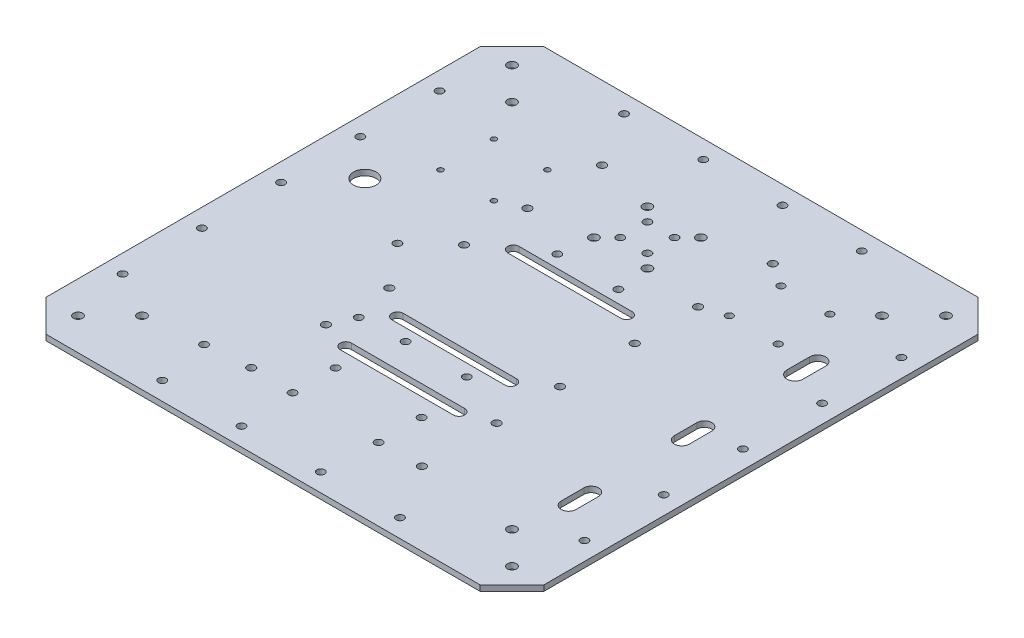
from build123d import *

# Parameters (mm, degrees)
BOSS_EXTRUDE1_DEPTH = 3.175
SKETCH2_R           = 2.159
CUT_EXTRUDE1_DEPTH  = 257.37661277
CUT_EXTRUDE2_DEPTH  = 257.37661277
SKETCH7_R           = 1.524
CUT_EXTRUDE3_DEPTH  = 257.37661277
SKETCH10_R          = 2.159
CUT_EXTRUDE6_DEPTH  = 257.37661277
SKETCH9_R           = 2.032
CUT_EXTRUDE5_DEPTH  = 257.37661277
SKETCH13_R          = 2.54
SKETCH13_R_2        = 2.159
CUT_EXTRUDE8_DEPTH  = 257.37661277
SKETCH14_R          = 2.54
CUT_EXTRUDE9_DEPTH  = 257.37661277
SKETCH15_R          = 2.159
CUT_EXTRUDE10_DEPTH = 257.37661277
SKETCH17_R          = 2.2225
CUT_EXTRUDE13_DEPTH = 257.37661277
CUT_EXTRUDE14_DEPTH = 257.37661277
SKETCH20_R          = 6.35
CUT_EXTRUDE15_DEPTH = 257.37661277
SKETCH22_R          = 2.159
CUT_EXTRUDE16_DEPTH = 257.37661277


with BuildPart() as part:
    # Sketch1 → Boss-Extrude1 (new body)
    with BuildSketch(Plane(origin=(0, 0, 0), x_dir=(1, 0, 0), z_dir=(0, 1, 0))):
        Polygon((-142.524216069, 79.491173458), (-160.484728311, 61.530661216), (-160.484728311, -181.9483143), (-142.524216069, -199.908826542), (100.954759447, -199.908826542), (118.915271689, -181.9483143), (118.915271689, 61.530661216), (100.954759447, 79.491173458), align=None)
    extrude(amount=BOSS_EXTRUDE1_DEPTH)

    # Sketch2 → Cut-Extrude1 (cut, through all)
    with BuildSketch(Plane(origin=(0, 3.175, 0), x_dir=(1, 0, 0), z_dir=(0, 1, 0))):
        with Locations((-38.056728311, -17.536826542)):
            Circle(SKETCH2_R)
        with Locations((-3.766728311, -17.536826542)):
            Circle(SKETCH2_R)
        with Locations((-38.056728311, -102.626826542)):
            Circle(SKETCH2_R)
        with Locations((-3.766728311, -102.626826542)):
            Circle(SKETCH2_R)
    extrude(amount=-CUT_EXTRUDE1_DEPTH, mode=Mode.SUBTRACT)

    # Sketch4 → Cut-Extrude2 (cut, through all)
    with BuildSketch(Plane(origin=(0, 3.175, 0), x_dir=(1, 0, 0), z_dir=(0, 1, 0))):
        with BuildLine():
            Line((-52.534728311, -24.533826542), (10.965271689, -24.533826542))
            ThreePointArc((10.965271689, -24.533826542), (14.140271689, -27.708826542), (10.965271689, -30.883826542))
            Line((10.965271689, -30.883826542), (-52.534728311, -30.883826542))
            ThreePointArc((-52.534728311, -30.883826542), (-55.709728311, -27.708826542), (-52.534728311, -24.533826542))
        make_face()
        with BuildLine():
            Line((-52.534728311, -89.533826542), (10.965271689, -89.533826542))
            ThreePointArc((10.965271689, -89.533826542), (14.140271689, -92.708826542), (10.965271689, -95.883826542))
            Line((10.965271689, -95.883826542), (-52.534728311, -95.883826542))
            ThreePointArc((-52.534728311, -95.883826542), (-55.709728311, -92.708826542), (-52.534728311, -89.533826542))
        make_face()
        with BuildLine():
            Line((-52.534728311, -118.533006542), (10.965271689, -118.533006542))
            ThreePointArc((10.965271689, -118.533006542), (14.140271689, -121.708006542), (10.965271689, -124.883006542))
            Line((10.965271689, -124.883006542), (-52.534728311, -124.883006542))
            ThreePointArc((-52.534728311, -124.883006542), (-55.709728311, -121.708006542), (-52.534728311, -118.533006542))
        make_face()
    extrude(amount=-CUT_EXTRUDE2_DEPTH, mode=Mode.SUBTRACT)

    # Sketch7 → Cut-Extrude3 (cut, through all)
    with BuildSketch(Plane(origin=(0, 3.175, 0), x_dir=(1, 0, 0), z_dir=(0, 1, 0))):
        with Locations((-81.744728311, 20.563173458)):
            Circle(SKETCH7_R)
        with Locations((-81.744728311, -9.408826542)):
            Circle(SKETCH7_R)
        with Locations((-111.716728311, -9.408826542)):
            Circle(SKETCH7_R)
        with Locations((-111.716728311, 20.563173458)):
            Circle(SKETCH7_R)
    extrude(amount=-CUT_EXTRUDE3_DEPTH, mode=Mode.SUBTRACT)

    # Sketch10 → Cut-Extrude6 (cut, through all)
    with BuildSketch(Plane.XZ):
        with Locations((-44.914728311, 159.173006542)):
            Circle(SKETCH10_R)
        with Locations((3.345271689, 159.173006542)):
            Circle(SKETCH10_R)
        with Locations((-44.914728311, 135.043006542)):
            Circle(SKETCH10_R)
        with Locations((3.345271689, 135.043006542)):
            Circle(SKETCH10_R)
    extrude(amount=-CUT_EXTRUDE6_DEPTH, mode=Mode.SUBTRACT)

    # Sketch9 → Cut-Extrude5 (cut, through all)
    with BuildSketch(Plane(origin=(0, 0, 0), x_dir=(-1, 0, 0), z_dir=(0, -1, 0))):
        with Locations((-40.175271689, 0.751173458)):
            Circle(SKETCH9_R)
        with Locations((-67.607271689, 0.751173458)):
            Circle(SKETCH9_R)
        with Locations((-40.175271689, 29.707173458)):
            Circle(SKETCH9_R)
        with Locations((-67.607271689, 29.707173458)):
            Circle(SKETCH9_R)
    extrude(amount=-CUT_EXTRUDE5_DEPTH, mode=Mode.SUBTRACT)

    # Sketch13 → Cut-Extrude8 (cut, through all)
    with BuildSketch(Plane.XZ):
        with Locations((-35.784728311, -0.751173458)):
            Circle(SKETCH13_R)
        with Locations((-35.784728311, -30.751173458)):
            Circle(SKETCH13_R)
        with Locations((-5.784728311, -30.751173458)):
            Circle(SKETCH13_R)
        with Locations((-5.784728311, -0.751173458)):
            Circle(SKETCH13_R)
        with Locations((-28.404728311, -23.371173458)):
            Circle(SKETCH13_R_2)
        with Locations((-28.404728311, -8.131173458)):
            Circle(SKETCH13_R_2)
        with Locations((-13.164728311, -8.131173458)):
            Circle(SKETCH13_R_2)
        with Locations((-13.164728311, -23.371173458)):
            Circle(SKETCH13_R_2)
    extrude(amount=-CUT_EXTRUDE8_DEPTH, mode=Mode.SUBTRACT)

    # Sketch14 → Cut-Extrude9 (cut, through all)
    with BuildSketch(Plane.XZ):
        with Locations((-142.524216069, 181.9483143)):
            Circle(SKETCH14_R)
        with Locations((-124.563703827, 163.987802058)):
            Circle(SKETCH14_R)
        with Locations((82.994247204, 163.987802058)):
            Circle(SKETCH14_R)
        with Locations((100.954759447, 181.9483143)):
            Circle(SKETCH14_R)
        with Locations((-142.524216069, -61.530661216)):
            Circle(SKETCH14_R)
        with Locations((-124.563703827, -43.570148974)):
            Circle(SKETCH14_R)
        with Locations((100.954759447, -61.530661216)):
            Circle(SKETCH14_R)
        with Locations((82.994247204, -43.570148974)):
            Circle(SKETCH14_R)
    extrude(amount=-CUT_EXTRUDE9_DEPTH, mode=Mode.SUBTRACT)

    # Sketch15 → Cut-Extrude10 (cut, through all)
    with BuildSketch(Plane.XZ):
        with Locations((-43.009728311, 189.748826542)):
            Circle(SKETCH15_R)
        with Locations((-87.459728311, 189.748826542)):
            Circle(SKETCH15_R)
        with Locations((-150.324728311, 60.208826542)):
            Circle(SKETCH15_R)
        with Locations((-150.324728311, 104.658826542)):
            Circle(SKETCH15_R)
        with Locations((-150.324728311, 149.108826542)):
            Circle(SKETCH15_R)
        with Locations((108.755271689, 149.108826542)):
            Circle(SKETCH15_R)
        with Locations((108.755271689, 104.658826542)):
            Circle(SKETCH15_R)
        with Locations((108.755271689, 60.208826542)):
            Circle(SKETCH15_R)
        with Locations((45.890271689, 189.748826542)):
            Circle(SKETCH15_R)
        with Locations((1.440271689, 189.748826542)):
            Circle(SKETCH15_R)
        with Locations((1.440271689, -69.331173458)):
            Circle(SKETCH15_R)
        with Locations((45.890271689, -69.331173458)):
            Circle(SKETCH15_R)
        with Locations((108.755271689, 15.758826542)):
            Circle(SKETCH15_R)
        with Locations((108.755271689, -28.691173458)):
            Circle(SKETCH15_R)
        with Locations((-150.324728311, -28.691173458)):
            Circle(SKETCH15_R)
        with Locations((-150.324728311, 15.758826542)):
            Circle(SKETCH15_R)
        with Locations((-87.459728311, -69.331173458)):
            Circle(SKETCH15_R)
        with Locations((-43.009728311, -69.331173458)):
            Circle(SKETCH15_R)
    extrude(amount=-CUT_EXTRUDE10_DEPTH, mode=Mode.SUBTRACT)

    # Sketch17 → Cut-Extrude13 (cut, through all)
    with BuildSketch(Plane(origin=(0, 3.175, 0), x_dir=(1, 0, 0), z_dir=(0, 1, 0))):
        with Locations((27.094271689, -158.633826542)):
            Circle(SKETCH17_R)
        with Locations((-68.663728311, -158.633826542)):
            Circle(SKETCH17_R)
        with Locations((27.094271689, -116.723826542)):
            Circle(SKETCH17_R)
        with Locations((-68.663728311, -116.723826542)):
            Circle(SKETCH17_R)
        with Locations((27.094271689, -81.163826542)):
            Circle(SKETCH17_R)
        with Locations((-68.663728311, -81.163826542)):
            Circle(SKETCH17_R)
        with Locations((27.094271689, -39.253826542)):
            Circle(SKETCH17_R)
        with Locations((-68.663728311, -39.253826542)):
            Circle(SKETCH17_R)
        with Locations((27.094271689, -3.693826542)):
            Circle(SKETCH17_R)
        with Locations((-68.663728311, -3.693826542)):
            Circle(SKETCH17_R)
        with Locations((27.094271689, 38.216173458)):
            Circle(SKETCH17_R)
        with Locations((-68.663728311, 38.216173458)):
            Circle(SKETCH17_R)
    extrude(amount=-CUT_EXTRUDE13_DEPTH, mode=Mode.SUBTRACT)

    # Sketch19 → Cut-Extrude14 (cut, through all)
    with BuildSketch(Plane(origin=(0, 3.175, 0), x_dir=(1, 0, 0), z_dir=(0, 1, 0))):
        with BuildLine():
            Line((83.016850731, -136.408826542), (83.016850731, -123.708826542))
            ThreePointArc((83.016850731, -123.708826542), (87.165271689, -119.560405585), (91.313692646, -123.708826542))
            Line((91.313692646, -123.708826542), (91.313692646, -136.408826542))
            ThreePointArc((91.313692646, -136.408826542), (87.165271689, -140.5572475), (83.016850731, -136.408826542))
        make_face()
        with BuildLine():
            Line((83.016850731, -72.908826542), (83.016850731, -60.208826542))
            ThreePointArc((83.016850731, -60.208826542), (87.165271689, -56.060405585), (91.313692646, -60.208826542))
            Line((91.313692646, -60.208826542), (91.313692646, -72.908826542))
            ThreePointArc((91.313692646, -72.908826542), (87.165271689, -77.0572475), (83.016850731, -72.908826542))
        make_face()
        with BuildLine():
            Line((82.671148985, -9.408826542), (82.671148985, 3.291173458))
            ThreePointArc((82.671148985, 3.291173458), (87.165271689, 7.785296162), (91.659394393, 3.291173458))
            Line((91.659394393, 3.291173458), (91.659394393, -9.408826542))
            ThreePointArc((91.659394393, -9.408826542), (87.165271689, -13.902949246), (82.671148985, -9.408826542))
        make_face()
    extrude(amount=-CUT_EXTRUDE14_DEPTH, mode=Mode.SUBTRACT)

    # Sketch20 → Cut-Extrude15 (cut, through all)
    with BuildSketch(Plane(origin=(0, 3.175, 0), x_dir=(1, 0, 0), z_dir=(0, 1, 0))):
        with Locations((-128.734728311, -34.808826542)):
            Circle(SKETCH20_R)
    extrude(amount=-CUT_EXTRUDE15_DEPTH, mode=Mode.SUBTRACT)

    # Sketch22 → Cut-Extrude16 (cut, through all)
    with BuildSketch(Plane(origin=(0, 3.175, 0), x_dir=(1, 0, 0), z_dir=(0, 1, 0))):
        with Locations((-88.094728311, -57.206716591)):
            Circle(SKETCH22_R)
        with Locations((-62.948728311, -104.029076591)):
            Circle(SKETCH22_R)
        with Locations((-93.174728311, -160.584716591)):
            Circle(SKETCH22_R)
    extrude(amount=-CUT_EXTRUDE16_DEPTH, mode=Mode.SUBTRACT)


solid = part.part
